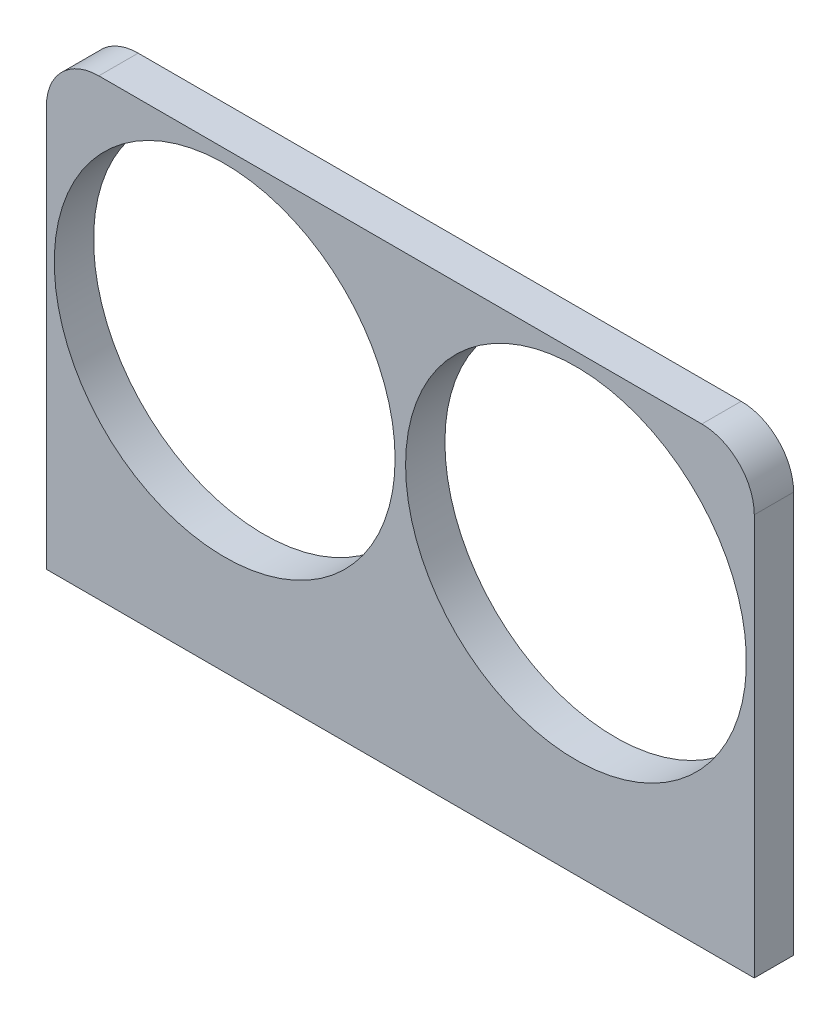
from build123d import *

# Parameters (mm, degrees)
SKETCH1_W           = 27
SKETCH1_H           = 17.3
SKETCH1_R           = 6.5
BOSS_EXTRUDE1_DEPTH = 1.5
FILLET1_R           = 2


with BuildPart() as part:
    # Sketch1 → Boss-Extrude1 (new body)
    with BuildSketch(Plane.XY):
        Rectangle(SKETCH1_W, SKETCH1_H)
        with Locations((-6.7, 1.65)):
            Circle(SKETCH1_R, mode=Mode.SUBTRACT)
        with Locations((6.7, 1.65)):
            Circle(SKETCH1_R, mode=Mode.SUBTRACT)
    extrude(amount=BOSS_EXTRUDE1_DEPTH)

    # Fillet1
    fillet1_edges = [part.edges().sort_by_distance(p)[0] for p in [
        (13.5, 8.65, 0.75),
        (-13.5, 8.65, 0.75),
    ]]
    fillet(fillet1_edges, radius=FILLET1_R)


solid = part.part
